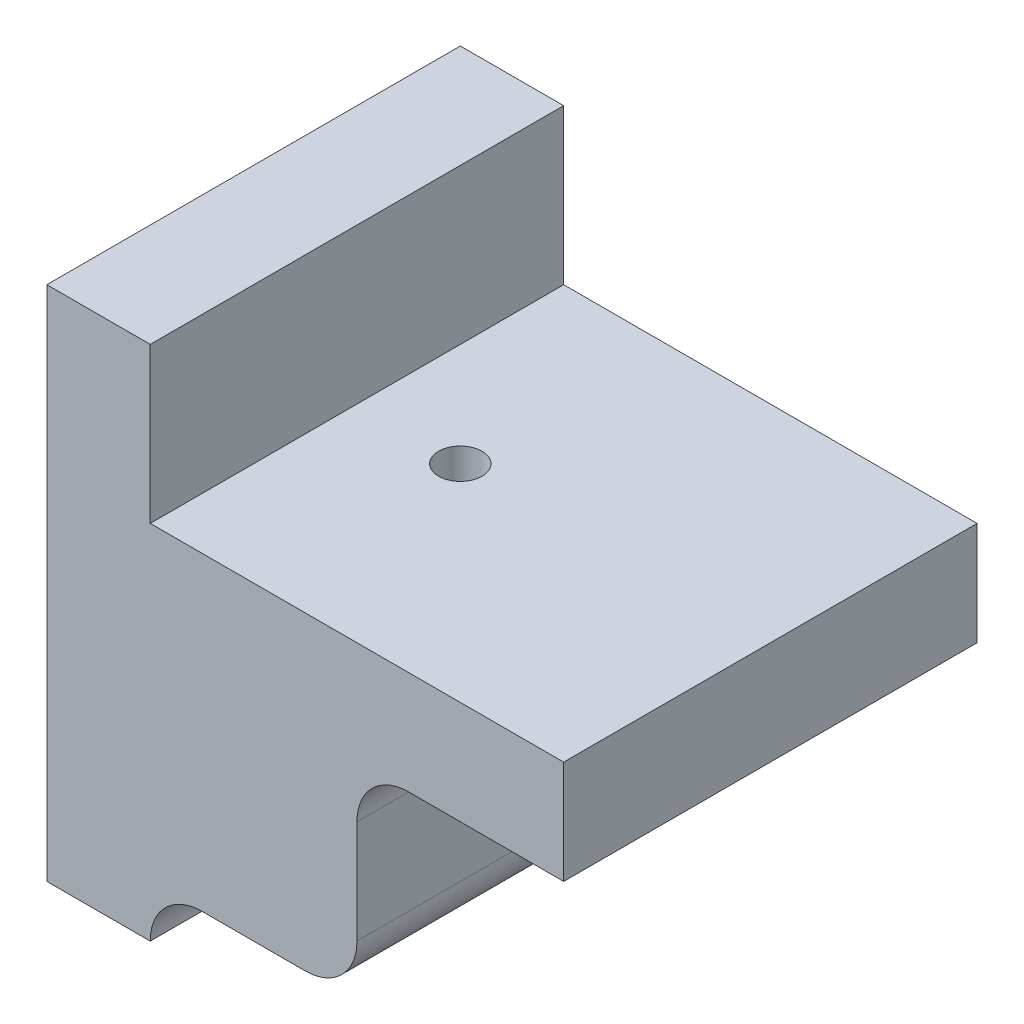
from build123d import *

# Parameters (mm, degrees)
BOSS_EXTRU_1_DEPTH    = 20
CONG_1_R              = 5
TROU_TARAUD_M51_D     = 4.2
TROU_TARAUD_M51_DEPTH = 25
TROU_TARAUD_M51_TIP   = 1.2618073


with BuildPart() as part:
    # Esquisse1 → Boss.-Extru.1 (new, symmetric)
    with BuildSketch(Plane.XY):
        Polygon((-20, 15), (-20, -35), (-10, -35), (-10, -30), (10, -30), (10, -10), (30, -10), (30, 0), (-10, 0), (-10, 15), align=None)
    extrude(amount=BOSS_EXTRU_1_DEPTH, both=True)

    # Congé1
    cong_1_edges = [part.edges().sort_by_distance(p)[0] for p in [
        (-10, -30, 0),
        (10, -10, 0),
        (10, -30, 0),
    ]]
    fillet(cong_1_edges, radius=CONG_1_R - 0.0001)  # a hair under: the kernel refuses the full size

    # Trou taraudé M51
    with Locations(Plane(origin=(0, 0, 0), x_dir=(1, 0, 0), z_dir=(0, 1, 0))):
        with Locations((0, 0)):
            Hole(TROU_TARAUD_M51_D / 2, depth=TROU_TARAUD_M51_DEPTH)
            with Locations((0, 0, -(TROU_TARAUD_M51_DEPTH + TROU_TARAUD_M51_TIP / 2))):  # 118° drill point
                Cone(0, TROU_TARAUD_M51_D / 2, TROU_TARAUD_M51_TIP, mode=Mode.SUBTRACT)


solid = part.part
